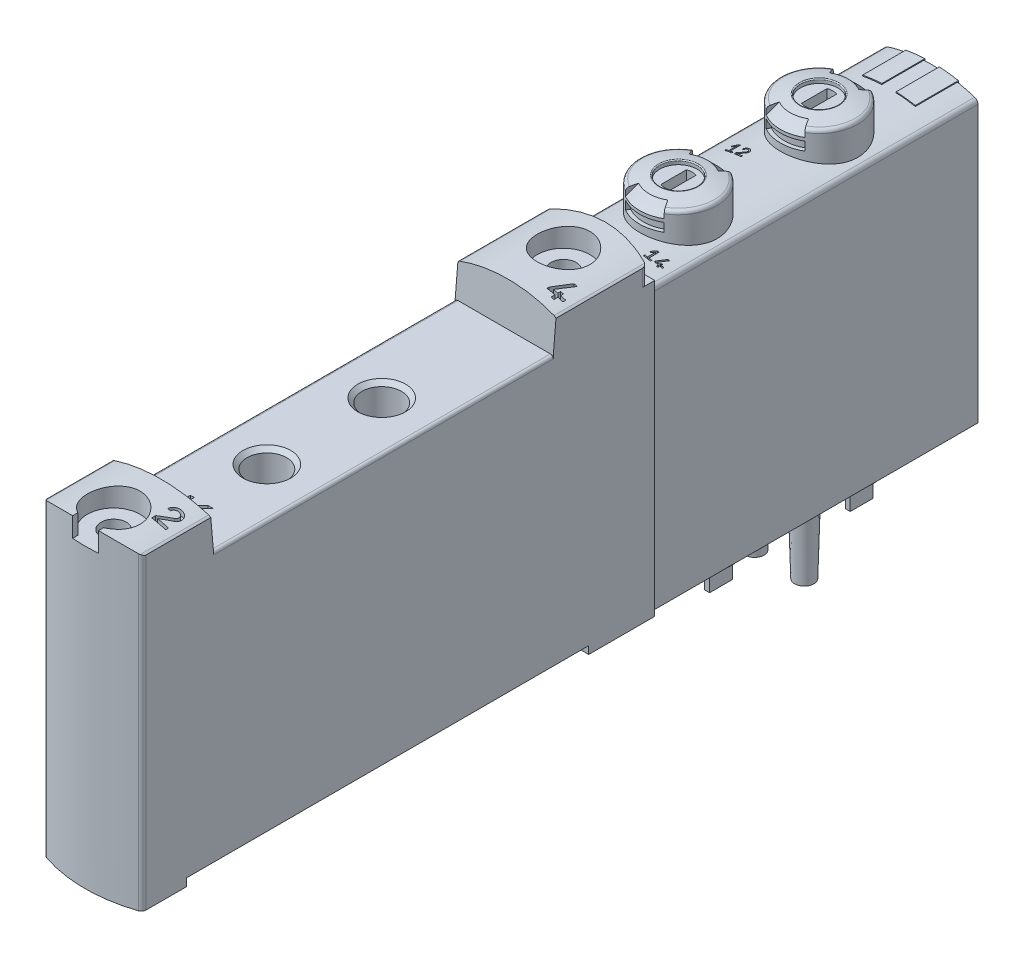
from build123d import *

# Parameters (mm, degrees)
BOSS_EXTRUDE1_DEPTH          = 34
CUT_EXTRUDE1_DEPTH           = 6
CUT_EXTRUDE1_DEPTH_BACK      = 6
SKETCH2_W                    = 34.1
SKETCH2_H                    = 0.4
CUT_EXTRUDE2_DEPTH           = 1.9
CUT_EXTRUDE3_DEPTH           = 1.9
SKETCH9_W                    = 0.5
SKETCH9_H                    = 2.4
BOSS_EXTRUDE2_DEPTH          = 2.5
SKETCH10_W                   = 0.5
SKETCH10_H                   = 2.4
BOSS_EXTRUDE3_DEPTH          = 2.5
SKETCH11_W                   = 0.5
SKETCH11_H                   = 2.4
BOSS_EXTRUDE4_DEPTH          = 2.5
SKETCH12_W                   = 0.5
SKETCH12_H                   = 2.4
BOSS_EXTRUDE5_DEPTH          = 2.5
CUT_REVOLVE1_ANGLE           = 30
CUT_REVOLVE1_OTHER_WAY_ANGLE = 30
CUT_REVOLVE2_ANGLE           = 30
CUT_REVOLVE2_OTHER_WAY_ANGLE = 30
CUT_EXTRUDE4_DEPTH           = 1.7
CUT_REVOLVE3_ANGLE           = 30
CUT_REVOLVE3_OTHER_WAY_ANGLE = 30
CUT_REVOLVE4_ANGLE           = 30
CUT_REVOLVE4_OTHER_WAY_ANGLE = 30
CUT_EXTRUDE5_DEPTH           = 1.7
BOSS_EXTRUDE6_DEPTH          = 4.5
BOSS_EXTRUDE7_DEPTH          = 4.5
BOSS_EXTRUDE8_DEPTH          = 33.1
CUT_EXTRUDE6_DEPTH           = 10
CUT_EXTRUDE6_DEPTH_BACK      = 10
CUT_EXTRUDE7_DEPTH           = 10
CUT_EXTRUDE8_DEPTH           = 10
CUT_EXTRUDE8_DEPTH_BACK      = 10
SKETCH26_W                   = 42
SKETCH26_H                   = 1
CUT_EXTRUDE9_DEPTH           = 55
CUT_EXTRUDE10_DEPTH          = 35.5
CUT_EXTRUDE11_DEPTH          = 2.1
CUT_EXTRUDE11_DEPTH_BACK     = 2.1
SKETCH30_W                   = 1.325
SKETCH30_H                   = 31
CUT_EXTRUDE12_DEPTH          = 3.5
CUT_EXTRUDE12_DEPTH_BACK     = 3.5
CUT_EXTRUDE13_DEPTH          = 3.5
CUT_EXTRUDE13_DEPTH_BACK     = 3.5
CUT_EXTRUDE14_DEPTH          = 3.5
CUT_EXTRUDE14_DEPTH_BACK     = 3.5
CUT_EXTRUDE15_DEPTH          = 3.5
CUT_EXTRUDE15_DEPTH_BACK     = 3.5
CUT_EXTRUDE16_DEPTH          = 1
CUT_EXTRUDE16_DEPTH_BACK     = 1
CUT_EXTRUDE17_DEPTH          = 1
CUT_EXTRUDE17_DEPTH_BACK     = 1
CUT_EXTRUDE18_DEPTH          = 4.5
CUT_EXTRUDE18_DEPTH_BACK     = 4.5


with BuildPart() as part:
    # Sketch1 → Boss-Extrude1 (new body)
    with BuildSketch(Plane.XY.offset(-23.2)):
        with BuildLine():
            Line((-4.9, 29.216294728), (-4.9, 0))
            Line((-4.9, 0), (4.9, 0))
            Line((4.9, 0), (4.9, 29.216294728))
            ThreePointArc((4.9, 29.216294728), (4.803647166, 29.511369236), (4.551724138, 29.692718684))
            ThreePointArc((4.551724138, 29.692718684), (0, 30.4), (-4.551724138, 29.692718684))
            ThreePointArc((-4.551724138, 29.692718684), (-4.803647166, 29.511369236), (-4.9, 29.216294728))
        make_face()
    extrude(amount=BOSS_EXTRUDE1_DEPTH)

    # Sketch2 → Cut-Extrude1 (cut, two sides: drawn at the far end of the back side and taken through both)
    with BuildSketch(Plane(origin=(0, 0, 0), x_dir=(0, 0, -1), z_dir=(1, 0, 0)).offset(-CUT_EXTRUDE1_DEPTH_BACK)):
        with Locations((6.17, 0.2)):
            Rectangle(SKETCH2_W, SKETCH2_H)
    extrude(amount=CUT_EXTRUDE1_DEPTH + CUT_EXTRUDE1_DEPTH_BACK, mode=Mode.SUBTRACT)

    # Sketch3 → Cut-Extrude2 (cut)
    with BuildSketch(Plane(origin=(0, 0, 0), x_dir=(1, 0, 0), z_dir=(0, 1, 0))):
        with BuildLine():
            Line((-3.15, 2.465258607), (-3.15, -2.465258607))
            ThreePointArc((-3.15, -2.465258607), (0, -4), (3.15, -2.465258607))
            Line((3.15, -2.465258607), (3.15, 2.465258607))
            ThreePointArc((3.15, 2.465258607), (0, 4), (-3.15, 2.465258607))
        make_face()
    extrude(amount=CUT_EXTRUDE2_DEPTH, mode=Mode.SUBTRACT)

    # Sketch4 → Cut-Extrude3 (cut)
    with BuildSketch(Plane(origin=(0, 0, 0), x_dir=(1, 0, 0), z_dir=(0, 1, 0))):
        with BuildLine():
            Line((-3.15, 17.165258607), (-3.15, 12.234741393))
            ThreePointArc((-3.15, 12.234741393), (0, 10.7), (3.15, 12.234741393))
            Line((3.15, 12.234741393), (3.15, 17.165258607))
            ThreePointArc((3.15, 17.165258607), (0, 18.7), (-3.15, 17.165258607))
        make_face()
    extrude(amount=CUT_EXTRUDE3_DEPTH, mode=Mode.SUBTRACT)

    # Sketch5 → Revolve1 (revolve)
    with BuildSketch(Plane(origin=(0, 0, 0), x_dir=(0, 0, -1), z_dir=(1, 0, 0))):
        Polygon((0, 2.1), (3.05, 2.1), (3.05, 1.1), (2.25, 1.1), (2.25, -1.4), (2.65, -1.4), (2.65, -1.72), (2.430606898, -2.1), (0, -2.1), align=None)
    revolve(axis=Axis((0, -2.1, 0), (0, 1, 0)))

    # Sketch6 → Revolve2 (revolve)
    with BuildSketch(Plane(origin=(0, 0, 0), x_dir=(0, 0, -1), z_dir=(1, 0, 0))):
        Polygon((14.7, 2.1), (17.75, 2.1), (17.75, 1.1), (16.95, 1.1), (16.95, -1.4), (17.35, -1.4), (17.35, -1.72), (17.130606898, -2.1), (14.7, -2.1), align=None)
    revolve(axis=Axis((0, -2.1, -14.7), (0, 1, 0)))

    # Sketch7 → Revolve3 (revolve)
    with BuildSketch(Plane.XY.offset(-7.35)):
        with BuildLine():
            Line((2.6, 0.4), (3.8, 0.4))
            Line((3.8, 0.4), (3.6, -6.9))
            ThreePointArc((3.6, -6.9), (3.106540729, -7.021444616), (2.6, -7.06227766))
            Line((2.6, -7.06227766), (2.6, 0.4))
        make_face()
    revolve(axis=Axis((2.6, -7.06227766, -7.35), (0, 1, 0)))

    # Sketch8 → Revolve4 (revolve)
    with BuildSketch(Plane.XY.offset(-7.35)):
        with BuildLine():
            Line((-2.6, 0.4), (-1.4, 0.4))
            Line((-1.4, 0.4), (-1.6, -6.9))
            ThreePointArc((-1.6, -6.9), (-2.093459271, -7.021444616), (-2.6, -7.06227766))
            Line((-2.6, -7.06227766), (-2.6, 0.4))
        make_face()
    revolve(axis=Axis((-2.6, -7.06227766, -7.35), (0, 1, 0)))

    # Sketch9 → Boss-Extrude2 (add)
    with BuildSketch(Plane(origin=(0, -2.1, 0), x_dir=(-1, 0, 0), z_dir=(0, -1, 0))):
        with Locations((-1, 0)):
            Rectangle(SKETCH9_W, SKETCH9_H)
    extrude(amount=BOSS_EXTRUDE2_DEPTH)

    # Sketch10 → Boss-Extrude3 (add)
    with BuildSketch(Plane(origin=(0, -2.1, 0), x_dir=(-1, 0, 0), z_dir=(0, -1, 0))):
        with Locations((1, 0)):
            Rectangle(SKETCH10_W, SKETCH10_H)
    extrude(amount=BOSS_EXTRUDE3_DEPTH)

    # Sketch11 → Boss-Extrude4 (add)
    with BuildSketch(Plane(origin=(0, -2.1, 0), x_dir=(-1, 0, 0), z_dir=(0, -1, 0))):
        with Locations((-1, 14.7)):
            Rectangle(SKETCH11_W, SKETCH11_H)
    extrude(amount=BOSS_EXTRUDE4_DEPTH)

    # Sketch12 → Boss-Extrude5 (add)
    with BuildSketch(Plane(origin=(0, -2.1, 0), x_dir=(-1, 0, 0), z_dir=(0, -1, 0))):
        with Locations((1, 14.7)):
            Rectangle(SKETCH12_W, SKETCH12_H)
    extrude(amount=BOSS_EXTRUDE5_DEPTH)

    # Sketch13 → Revolve5 (revolve)
    with BuildSketch(Plane(origin=(0, 0, 0), x_dir=(0, 0, -1), z_dir=(1, 0, 0))):
        with BuildLine():
            Line((-3.2, 33.13), (-1.25, 33.13))
            Line((-1.25, 33.13), (-1.25, 33.458302748))
            ThreePointArc((-1.25, 33.458302748), (-1.215666434, 33.533721045), (-1.136241611, 33.55735176))
            ThreePointArc((-1.136241611, 33.55735176), (-0.28833743, 33.414694053), (0.549999769, 33.223687608))
            ThreePointArc((0.549999769, 33.223687608), (0.766227693, 33.081338282), (0.85, 32.836389214))
            Line((0.85, 32.836389214), (0.85, 28.4))
            Line((0.85, 28.4), (-3.2, 28.4))
            Line((-3.2, 28.4), (-3.2, 33.13))
        make_face()
    revolve(axis=Axis((0, 28.4, 3.2), (0, 1, 0)))

    # Sketch14 → Revolve6 (revolve)
    with BuildSketch(Plane(origin=(0, 0, 0), x_dir=(0, 0, -1), z_dir=(1, 0, 0))):
        with BuildLine():
            Line((11.5, 33.13), (13.45, 33.13))
            Line((13.45, 33.13), (13.45, 33.458302748))
            ThreePointArc((13.45, 33.458302748), (13.484333566, 33.533721045), (13.563758389, 33.55735176))
            ThreePointArc((13.563758389, 33.55735176), (14.411662804, 33.414694007), (15.250000231, 33.223687489))
            ThreePointArc((15.250000231, 33.223687489), (15.466227839, 33.081338094), (15.55, 32.836389214))
            Line((15.55, 32.836389214), (15.55, 28.4))
            Line((15.55, 28.4), (11.5, 28.4))
            Line((11.5, 28.4), (11.5, 33.13))
        make_face()
    revolve(axis=Axis((0, 28.4, -11.5), (0, 1, 0)))

    # Sketch15 → Cut-Revolve1 (revolve, cut)
    with BuildSketch(Plane(origin=(0, 0, 0), x_dir=(0, 0, -1), z_dir=(1, 0, 0))):
        Polygon((-0.47, 33.7), (0.9, 32.33), (0.9, 32.05), (0.45, 32.05), (0.45, 31.15), (0.9, 31.15), (0.9, 30.5), (1.3, 30.5), (1.3, 33.7), align=None)
    revolve(axis=Axis((0, 30.5, 3.2), (0, -1, 0)), revolution_arc=CUT_REVOLVE1_ANGLE, mode=Mode.SUBTRACT)

    # Sketch15 → Cut-Revolve1 other way (revolve, cut)
    with BuildSketch(Plane(origin=(0, 0, 0), x_dir=(0, 0, -1), z_dir=(1, 0, 0))):
        Polygon((-0.47, 33.7), (0.9, 32.33), (0.9, 32.05), (0.45, 32.05), (0.45, 31.15), (0.9, 31.15), (0.9, 30.5), (1.3, 30.5), (1.3, 33.7), align=None)
    revolve(axis=Axis((0, 30.5, 3.2), (0, 1, 0)), revolution_arc=CUT_REVOLVE1_OTHER_WAY_ANGLE, mode=Mode.SUBTRACT)

    # Sketch16 → Cut-Revolve2 (revolve, cut)
    with BuildSketch(Plane(origin=(0, 0, 0), x_dir=(0, 0, -1), z_dir=(1, 0, 0))):
        Polygon((-7.7, 30.5), (-7.3, 30.5), (-7.3, 31.15), (-6.85, 31.15), (-6.85, 32.05), (-7.3, 32.05), (-7.3, 32.33), (-5.93, 33.7), (-7.7, 33.7), align=None)
    revolve(axis=Axis((0, 33.7, 3.2), (0, 1, 0)), revolution_arc=CUT_REVOLVE2_ANGLE, mode=Mode.SUBTRACT)

    # Sketch16 → Cut-Revolve2 other way (revolve, cut)
    with BuildSketch(Plane(origin=(0, 0, 0), x_dir=(0, 0, -1), z_dir=(1, 0, 0))):
        Polygon((-7.7, 30.5), (-7.3, 30.5), (-7.3, 31.15), (-6.85, 31.15), (-6.85, 32.05), (-7.3, 32.05), (-7.3, 32.33), (-5.93, 33.7), (-7.7, 33.7), align=None)
    revolve(axis=Axis((0, 33.7, 3.2), (0, -1, 0)), revolution_arc=CUT_REVOLVE2_OTHER_WAY_ANGLE, mode=Mode.SUBTRACT)

    # Sketch17 → Cut-Extrude4 (cut)
    with BuildSketch(Plane(origin=(0, 33.13, 0), x_dir=(1, 0, 0), z_dir=(0, 1, 0))):
        with BuildLine():
            Line((0.5, -4.534400615), (0.5, -1.865599385))
            ThreePointArc((0.5, -1.865599385), (0, -1.775), (-0.5, -1.865599385))
            Line((-0.5, -1.865599385), (-0.5, -4.534400615))
            ThreePointArc((-0.5, -4.534400615), (0, -4.625), (0.5, -4.534400615))
        make_face()
    extrude(amount=-CUT_EXTRUDE4_DEPTH, mode=Mode.SUBTRACT)

    # Sketch18 → Cut-Revolve3 (revolve, cut)
    with BuildSketch(Plane(origin=(0, 0, 0), x_dir=(0, 0, -1), z_dir=(1, 0, 0))):
        Polygon((14.23, 33.7), (15.6, 32.33), (15.6, 32.05), (15.15, 32.05), (15.15, 31.15), (15.6, 31.15), (15.6, 30.5), (16, 30.5), (16, 33.7), align=None)
    revolve(axis=Axis((0, 30.5, -11.5), (0, -1, 0)), revolution_arc=CUT_REVOLVE3_ANGLE, mode=Mode.SUBTRACT)

    # Sketch18 → Cut-Revolve3 other way (revolve, cut)
    with BuildSketch(Plane(origin=(0, 0, 0), x_dir=(0, 0, -1), z_dir=(1, 0, 0))):
        Polygon((14.23, 33.7), (15.6, 32.33), (15.6, 32.05), (15.15, 32.05), (15.15, 31.15), (15.6, 31.15), (15.6, 30.5), (16, 30.5), (16, 33.7), align=None)
    revolve(axis=Axis((0, 30.5, -11.5), (0, 1, 0)), revolution_arc=CUT_REVOLVE3_OTHER_WAY_ANGLE, mode=Mode.SUBTRACT)

    # Sketch19 → Cut-Revolve4 (revolve, cut)
    with BuildSketch(Plane(origin=(0, 0, 0), x_dir=(0, 0, -1), z_dir=(1, 0, 0))):
        Polygon((7, 30.5), (7.4, 30.5), (7.4, 31.15), (7.85, 31.15), (7.85, 32.05), (7.4, 32.05), (7.4, 32.33), (8.77, 33.7), (7, 33.7), align=None)
    revolve(axis=Axis((0, 33.7, -11.5), (0, 1, 0)), revolution_arc=CUT_REVOLVE4_ANGLE, mode=Mode.SUBTRACT)

    # Sketch19 → Cut-Revolve4 other way (revolve, cut)
    with BuildSketch(Plane(origin=(0, 0, 0), x_dir=(0, 0, -1), z_dir=(1, 0, 0))):
        Polygon((7, 30.5), (7.4, 30.5), (7.4, 31.15), (7.85, 31.15), (7.85, 32.05), (7.4, 32.05), (7.4, 32.33), (8.77, 33.7), (7, 33.7), align=None)
    revolve(axis=Axis((0, 33.7, -11.5), (0, -1, 0)), revolution_arc=CUT_REVOLVE4_OTHER_WAY_ANGLE, mode=Mode.SUBTRACT)

    # Sketch20 → Cut-Extrude5 (cut)
    with BuildSketch(Plane(origin=(0, 33.13, 0), x_dir=(1, 0, 0), z_dir=(0, 1, 0))):
        with BuildLine():
            Line((0.5, 10.165599385), (0.5, 12.834400615))
            ThreePointArc((0.5, 12.834400615), (0, 12.925), (-0.5, 12.834400615))
            Line((-0.5, 12.834400615), (-0.5, 10.165599385))
            ThreePointArc((-0.5, 10.165599385), (0, 10.075), (0.5, 10.165599385))
        make_face()
    extrude(amount=-CUT_EXTRUDE5_DEPTH, mode=Mode.SUBTRACT)

    # Sketch21 → Boss-Extrude6 (add)
    with BuildSketch(Plane.XY.offset(-23.3)):
        with BuildLine():
            Line((0.75, 30.481362671), (0.75, 27))
            Line((0.75, 27), (2.75, 27))
            Line((2.75, 27), (2.75, 30.247474533))
            ThreePointArc((2.75, 30.247474533), (1.753903052, 30.397793974), (0.75, 30.481362671))
        make_face()
    extrude(amount=BOSS_EXTRUDE6_DEPTH)

    # Sketch22 → Boss-Extrude7 (add)
    with BuildSketch(Plane.XY.offset(-23.3)):
        with BuildLine():
            Line((-2.75, 30.247474533), (-2.75, 27))
            Line((-2.75, 27), (-0.75, 27))
            Line((-0.75, 27), (-0.75, 30.481362671))
            ThreePointArc((-0.75, 30.481362671), (-1.753903052, 30.397793974), (-2.75, 30.247474533))
        make_face()
    extrude(amount=BOSS_EXTRUDE7_DEPTH)

    # Sketch23 → Boss-Extrude8 (add)
    with BuildSketch(Plane(origin=(0, 0, 0), x_dir=(1, 0, 0), z_dir=(0, 1, 0))):
        with BuildLine():
            Line((5.125, -63.942611651), (5.125, -10.8))
            Line((5.125, -10.8), (-5.125, -10.8))
            Line((-5.125, -10.8), (-5.125, -63.942611651))
            ThreePointArc((-5.125, -63.942611651), (-5.031042719, -64.234380927), (-4.784482759, -64.416494812))
            ThreePointArc((-4.784482759, -64.416494812), (0, -65.2), (4.784482759, -64.416494812))
            ThreePointArc((4.784482759, -64.416494812), (5.031042719, -64.234380927), (5.125, -63.942611651))
        make_face()
    extrude(amount=BOSS_EXTRUDE8_DEPTH)

    # Sketch24 → Cut-Extrude6 (cut, two sides: drawn at the far end of the back side and taken through both)
    with BuildSketch(Plane(origin=(0, 0, 0), x_dir=(0, 0, -1), z_dir=(1, 0, 0)).offset(-CUT_EXTRUDE6_DEPTH_BACK)):
        Polygon((-57.774886635, 38.9), (-56.9, 28.9), (-21.4, 28.9), (-20.525113365, 38.9), align=None)
    extrude(amount=CUT_EXTRUDE6_DEPTH + CUT_EXTRUDE6_DEPTH_BACK, mode=Mode.SUBTRACT)

    # Sketch25 → Cut-Extrude7 (cut)
    with BuildSketch(Plane(origin=(0, 30.4, 0), x_dir=(1, 0, 0), z_dir=(0, 1, 0))):
        with BuildLine():
            Line((-5.125, -8.8), (-5.125, -12.057388349))
            ThreePointArc((-5.125, -12.057388349), (-5.031042719, -11.765619073), (-4.784482759, -11.583505188))
            ThreePointArc((-4.784482759, -11.583505188), (0, -10.8), (4.784482759, -11.583505188))
            ThreePointArc((4.784482759, -11.583505188), (5.031042719, -11.765619073), (5.125, -12.057388349))
            Line((5.125, -12.057388349), (5.125, -8.8))
            Line((5.125, -8.8), (-5.125, -8.8))
        make_face()
    extrude(amount=CUT_EXTRUDE7_DEPTH, mode=Mode.SUBTRACT)

    # Sketch26 → Cut-Extrude8 (cut, two sides: drawn at the far end of the back side and taken through both)
    with BuildSketch(Plane(origin=(0, 0, 0), x_dir=(0, 0, -1), z_dir=(1, 0, 0)).offset(-CUT_EXTRUDE8_DEPTH_BACK)):
        with Locations((-38.7, 0.3)):
            Rectangle(SKETCH26_W, SKETCH26_H)
    extrude(amount=CUT_EXTRUDE8_DEPTH + CUT_EXTRUDE8_DEPTH_BACK, mode=Mode.SUBTRACT)

    # Sketch27 → Cut-Extrude9 (cut)
    with BuildSketch(Plane.XY.offset(10.8)):
        with BuildLine():
            Line((-5.25, 35.1), (-5.25, 31.799908759))
            ThreePointArc((-5.25, 31.799908759), (-5.157367495, 32.089825513), (-4.913793103, 32.272319406))
            ThreePointArc((-4.913793103, 32.272319406), (0, 33.1), (4.913793103, 32.272319406))
            ThreePointArc((4.913793103, 32.272319406), (5.157367495, 32.089825513), (5.25, 31.799908759))
            Line((5.25, 31.799908759), (5.25, 35.1))
            Line((5.25, 35.1), (-5.25, 35.1))
        make_face()
    extrude(amount=CUT_EXTRUDE9_DEPTH, mode=Mode.SUBTRACT)

    # Sketch28 → Cut-Extrude10 (cut)
    with BuildSketch(Plane.XY.offset(21.4)):
        with BuildLine():
            Line((-4.825, 28.9), (4.825, 28.9))
            ThreePointArc((4.825, 28.9), (5.037132034, 28.812132034), (5.125, 28.6))
            Line((5.125, 28.6), (5.125, 33.6))
            Line((5.125, 33.6), (-5.125, 33.6))
            Line((-5.125, 33.6), (-5.125, 28.6))
            ThreePointArc((-5.125, 28.6), (-5.037132034, 28.812132034), (-4.825, 28.9))
        make_face()
    extrude(amount=CUT_EXTRUDE10_DEPTH, mode=Mode.SUBTRACT)

    # Sketch29 → Cut-Extrude11 (cut, two sides: drawn at the far end of the back side and taken through both)
    with BuildSketch(Plane(origin=(0, 33.1, 0), x_dir=(1, 0, 0), z_dir=(0, 1, 0)).offset(-CUT_EXTRUDE11_DEPTH_BACK)):
        with BuildLine():
            Line((-1.35, -64.59582971), (-1.35, -66))
            Line((-1.35, -66), (1.35, -66))
            Line((1.35, -66), (1.35, -64.59582971))
            ThreePointArc((1.35, -64.59582971), (0, -59.45), (-1.35, -64.59582971))
        make_face()
    extrude(amount=CUT_EXTRUDE11_DEPTH + CUT_EXTRUDE11_DEPTH_BACK, mode=Mode.SUBTRACT)

    # Sketch30 → Cut-Revolve5 (revolve, cut)
    with BuildSketch(Plane(origin=(0, 0, 0), x_dir=(0, 0, -1), z_dir=(1, 0, 0))):
        with Locations((-61.5375, 15.5)):
            Rectangle(SKETCH30_W, SKETCH30_H)
    revolve(axis=Axis((0, 0, 62.2), (0, 1, 0)), mode=Mode.SUBTRACT)

    # Sketch31 → Cut-Revolve6 (revolve, cut)
    with BuildSketch(Plane(origin=(0, 0, 0), x_dir=(0, 0, -1), z_dir=(1, 0, 0))):
        Polygon((-15.2, 33.2), (-12.45, 33.2), (-12.45, 31), (-13.875, 31), (-13.875, 0), (-15.2, 0), align=None)
    revolve(axis=Axis((0, 0, 15.2), (0, 1, 0)), mode=Mode.SUBTRACT)

    # Sketch32 → Cut-Revolve7 (revolve, cut)
    with BuildSketch(Plane(origin=(0, 0, 0), x_dir=(0, 0, -1), z_dir=(1, 0, 0))):
        Polygon((-34.2, 28.9), (-31.7, 28.9), (-32.133, 28.467), (-32.133, 22.3), (-34.2, 22.3), align=None)
    revolve(axis=Axis((0, 22.3, 34.2), (0, 1, 0)), mode=Mode.SUBTRACT)

    # Sketch33 → Cut-Revolve8 (revolve, cut)
    with BuildSketch(Plane(origin=(0, 0, 0), x_dir=(0, 0, -1), z_dir=(1, 0, 0))):
        Polygon((-46.2, 28.9), (-43.7, 28.9), (-44.133, 28.467), (-44.133, 22.3), (-46.2, 22.3), align=None)
    revolve(axis=Axis((0, 22.3, 46.2), (0, 1, 0)), mode=Mode.SUBTRACT)

    # Sketch34 → Cut-Revolve9 (revolve, cut)
    with BuildSketch(Plane(origin=(0, 0, 0), x_dir=(0, 0, -1), z_dir=(1, 0, 0))):
        Polygon((-29.2, 7.3), (-27.1, 7.3), (-27.1, 2.8), (-26.2, 2.8), (-26.2, 1.3), (-25.7, 0.8), (-29.2, 0.8), align=None)
    revolve(axis=Axis((0, 0.8, 29.2), (0, 1, 0)), mode=Mode.SUBTRACT)

    # Sketch35 → Cut-Revolve10 (revolve, cut)
    with BuildSketch(Plane(origin=(0, 0, 0), x_dir=(0, 0, -1), z_dir=(1, 0, 0))):
        Polygon((-40.2, 7.3), (-38.1, 7.3), (-38.1, 2.8), (-37.2, 2.8), (-37.2, 1.3), (-36.7, 0.8), (-40.2, 0.8), align=None)
    revolve(axis=Axis((0, 0.8, 40.2), (0, 1, 0)), mode=Mode.SUBTRACT)

    # Sketch36 → Cut-Revolve11 (revolve, cut)
    with BuildSketch(Plane(origin=(0, 0, 0), x_dir=(0, 0, -1), z_dir=(1, 0, 0))):
        Polygon((-51.2, 7.3), (-49.1, 7.3), (-49.1, 2.8), (-48.2, 2.8), (-48.2, 1.3), (-47.7, 0.8), (-51.2, 0.8), align=None)
    revolve(axis=Axis((0, 0.8, 51.2), (0, 1, 0)), mode=Mode.SUBTRACT)

    # Sketch37 → Cut-Extrude12 (cut, two sides: drawn at the far end of the back side and taken through both)
    with BuildSketch(Plane(origin=(0, 33.1, 0), x_dir=(1, 0, 0), z_dir=(0, 1, 0)).offset(-CUT_EXTRUDE12_DEPTH_BACK)):
        Polygon((-3.398476194, 5.738028118), (-3.297824684, 5.667551171), (-3.075, 5.985777799), (-3.075, 5.15), (-3.375, 5.15), (-3.375, 5), (-2.625, 5), (-2.625, 5.15), (-2.925, 5.15), (-2.925, 6.2), (-3.075, 6.2), align=None)
    extrude(amount=CUT_EXTRUDE12_DEPTH + CUT_EXTRUDE12_DEPTH_BACK, mode=Mode.SUBTRACT)

    # Sketch38 → Cut-Extrude13 (cut, two sides: drawn at the far end of the back side and taken through both)
    with BuildSketch(Plane(origin=(0, 33.1, 0), x_dir=(1, 0, 0), z_dir=(0, 1, 0)).offset(-CUT_EXTRUDE13_DEPTH_BACK)):
        with BuildLine():
            Line((-2.3625, 5.8375), (-2.2125, 5.8375))
            ThreePointArc((-2.2125, 5.8375), (-1.915590111, 6.03251595), (-1.854559099, 5.682570356))
            Line((-1.854559099, 5.682570356), (-2.3625, 5.205738549))
            Line((-2.3625, 5.205738549), (-2.3625, 5))
            Line((-2.3625, 5), (-1.6375, 5))
            Line((-1.6375, 5), (-1.6375, 5.15))
            Line((-1.6375, 5.15), (-2.202713816, 5.15))
            Line((-2.202713816, 5.15), (-1.751894934, 5.573208255))
            ThreePointArc((-1.751894934, 5.573208255), (-1.85600666, 6.170174267), (-2.3625, 5.8375))
        make_face()
    extrude(amount=CUT_EXTRUDE13_DEPTH + CUT_EXTRUDE13_DEPTH_BACK, mode=Mode.SUBTRACT)

    # Sketch39 → Cut-Extrude14 (cut, two sides: drawn at the far end of the back side and taken through both)
    with BuildSketch(Plane(origin=(0, 33.1, 0), x_dir=(1, 0, 0), z_dir=(0, 1, 0)).offset(-CUT_EXTRUDE14_DEPTH_BACK)):
        Polygon((2.101523806, -8.261971882), (2.202175316, -8.332448829), (2.425, -8.014222201), (2.425, -8.85), (2.125, -8.85), (2.125, -9), (2.875, -9), (2.875, -8.85), (2.575, -8.85), (2.575, -7.8), (2.425, -7.8), align=None)
    extrude(amount=CUT_EXTRUDE14_DEPTH + CUT_EXTRUDE14_DEPTH_BACK, mode=Mode.SUBTRACT)

    # Sketch40 → Cut-Extrude15 (cut, two sides: drawn at the far end of the back side and taken through both)
    with BuildSketch(Plane(origin=(0, 33.1, 0), x_dir=(1, 0, 0), z_dir=(0, 1, 0)).offset(-CUT_EXTRUDE15_DEPTH_BACK)):
        Polygon((3.085, -8.8), (3.5, -8.8), (3.5, -9), (3.65, -9), (3.65, -8.8), (3.915, -8.8), (3.915, -8.65), (3.65, -8.65), (3.65, -8.5), (3.5, -8.5), (3.5, -8.65), (3.269946149, -8.65), (3.666307658, -7.8), (3.50080097, -7.8), (3.085, -8.691688058), align=None)
    extrude(amount=CUT_EXTRUDE15_DEPTH + CUT_EXTRUDE15_DEPTH_BACK, mode=Mode.SUBTRACT)

    # Sketch41 → Cut-Extrude16 (cut, two sides: drawn at the far end of the back side and taken through both)
    with BuildSketch(Plane(origin=(0, 33.1, 0), x_dir=(1, 0, 0), z_dir=(0, 1, 0)).offset(-CUT_EXTRUDE16_DEPTH_BACK)):
        Polygon((2.67, -19.6), (3.5, -19.6), (3.5, -20), (3.8, -20), (3.8, -19.6), (4.33, -19.6), (4.33, -19.3), (3.8, -19.3), (3.8, -19), (3.5, -19), (3.5, -19.3), (3.039892297, -19.3), (3.832615316, -17.6), (3.501601941, -17.6), (2.67, -19.383376117), align=None)
    extrude(amount=CUT_EXTRUDE16_DEPTH + CUT_EXTRUDE16_DEPTH_BACK, mode=Mode.SUBTRACT)

    # Sketch42 → Cut-Extrude17 (cut, two sides: drawn at the far end of the back side and taken through both)
    with BuildSketch(Plane(origin=(0, 33.1, 0), x_dir=(1, 0, 0), z_dir=(0, 1, 0)).offset(-CUT_EXTRUDE17_DEPTH_BACK)):
        with BuildLine():
            Line((2.775, -59.325), (3.075, -59.325))
            ThreePointArc((3.075, -59.325), (3.668819777, -58.9349681), (3.790881801, -59.634859287))
            Line((3.790881801, -59.634859287), (2.775, -60.588522903))
            Line((2.775, -60.588522903), (2.775, -61))
            Line((2.775, -61), (4.225, -61))
            Line((4.225, -61), (4.225, -60.7))
            Line((4.225, -60.7), (3.094572368, -60.7))
            Line((3.094572368, -60.7), (3.996210131, -59.85358349))
            ThreePointArc((3.996210131, -59.85358349), (3.787986679, -58.659651465), (2.775, -59.325))
        make_face()
    extrude(amount=CUT_EXTRUDE17_DEPTH + CUT_EXTRUDE17_DEPTH_BACK, mode=Mode.SUBTRACT)

    # Sketch43 → Cut-Extrude18 (cut, two sides: drawn at the far end of the back side and taken through both)
    with BuildSketch(Plane(origin=(0, 33.1, 0), x_dir=(1, 0, 0), z_dir=(0, 1, 0)).offset(-CUT_EXTRUDE18_DEPTH_BACK)):
        Polygon((-1.2, -53), (-1.2, -56), (-0.78, -56), (-0.78, -54.95), (-0.327272727, -54.504132231), (0.66, -56), (1.2, -56), (0, -54.181818182), (1.2, -53), (0.66, -53), (-0.78, -54.418181818), (-0.78, -53), align=None)
    extrude(amount=CUT_EXTRUDE18_DEPTH + CUT_EXTRUDE18_DEPTH_BACK, mode=Mode.SUBTRACT)


solid = part.part
